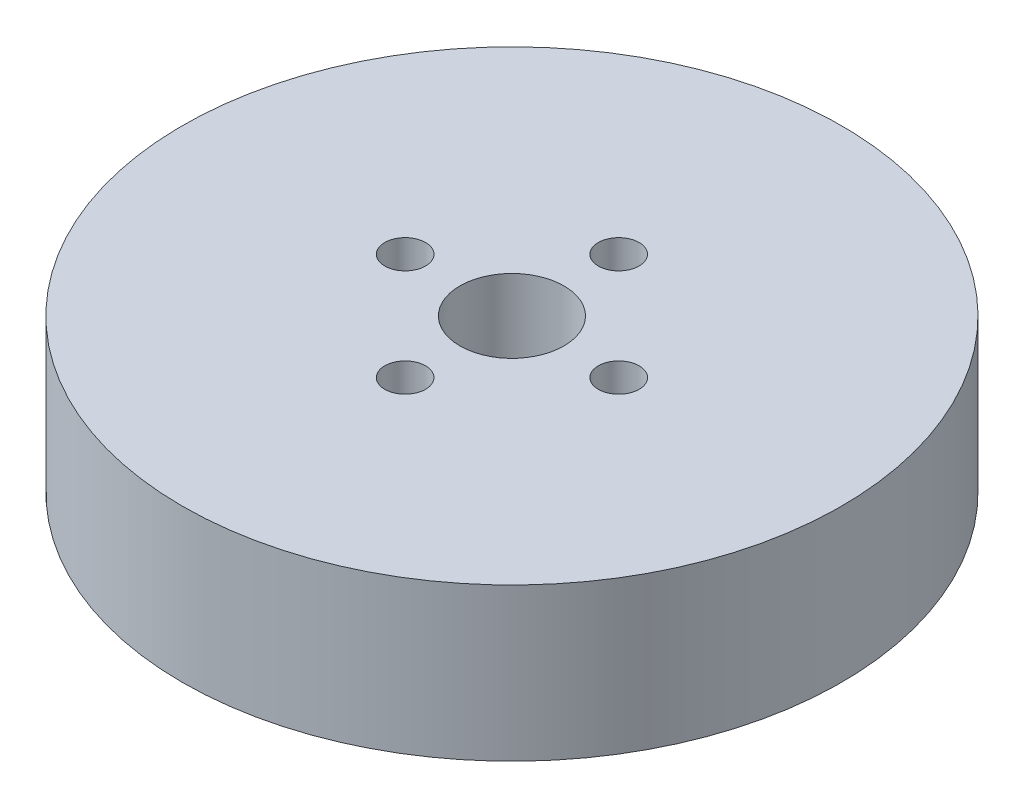
from build123d import *

# Parameters (mm, degrees)
SKETCH1_R           = 47.5
BOSS_EXTRUDE1_DEPTH = 22
SKETCH2_R           = 7.5
CUT_EXTRUDE1_DEPTH  = 71.685925049
SKETCH3_R           = 2.941253017
CUT_EXTRUDE2_DEPTH  = 17.222443085
CIRPATTERN1_COUNT   = 4


with BuildPart() as part:
    # Sketch1 → Boss-Extrude1 (new body)
    with BuildSketch(Plane(origin=(0, 0, 0), x_dir=(1, 0, 0), z_dir=(0, 1, 0))):
        Circle(SKETCH1_R)
    extrude(amount=BOSS_EXTRUDE1_DEPTH)

    # Sketch2 → Cut-Extrude1 (cut, through all)
    with BuildSketch(Plane(origin=(0, 0, 0), x_dir=(1, 0, 0), z_dir=(0, 1, 0))):
        Circle(SKETCH2_R)
    extrude(amount=CUT_EXTRUDE1_DEPTH, mode=Mode.SUBTRACT)

    # Sketch3 → Cut-Extrude2 (cut)
    with BuildSketch(Plane(origin=(0, 22, 0), x_dir=(1, 0, 0), z_dir=(0, 1, 0))):
        with Locations((-15.389278376, 0)):
            Circle(SKETCH3_R)
    cut_extrude2 = extrude(amount=-CUT_EXTRUDE2_DEPTH, mode=Mode.SUBTRACT)

    # CirPattern1: Cut-Extrude2 ×4 about axis
    cirpattern1_axis = Axis((0, 0, 0), (0, 1, 0))
    for i in range(1, CIRPATTERN1_COUNT):
        add(cut_extrude2.rotate(cirpattern1_axis, i * 360 / CIRPATTERN1_COUNT), mode=Mode.SUBTRACT)


solid = part.part
